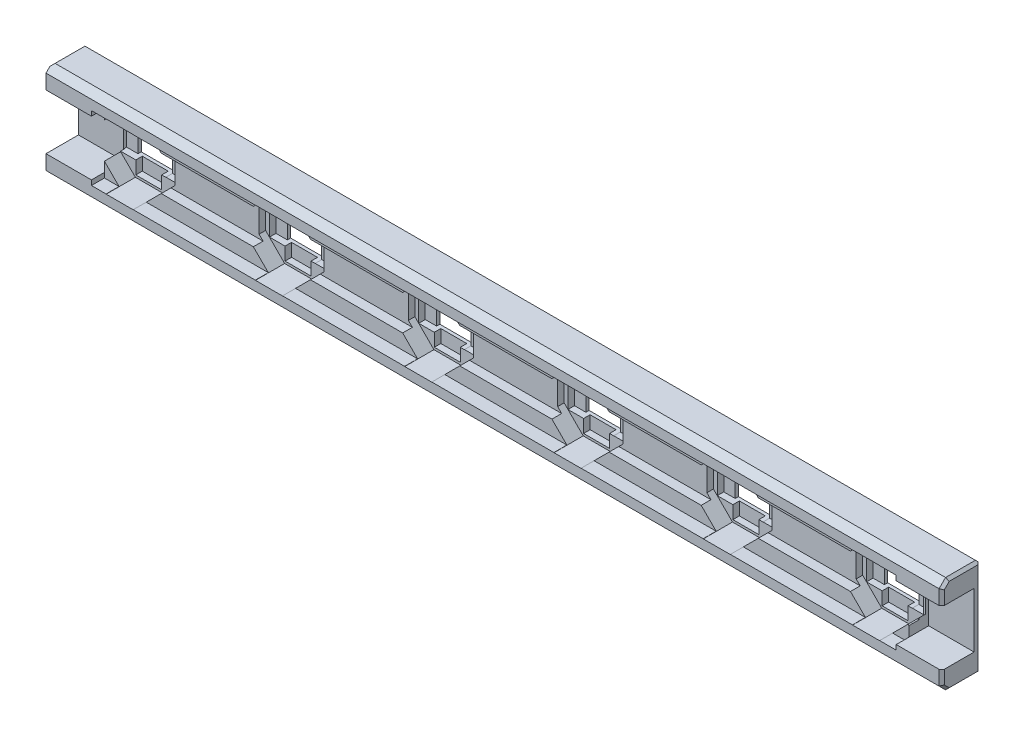
from build123d import *

# Parameters (mm, degrees)
SKETCH1_W                = 138
SKETCH1_H                = 15
BOSS_EXTRUDE1_DEPTH      = 6
CUT_EXTRUDE8_DEPTH       = 138
SKETCH13_W               = 0.5
SKETCH13_H               = 10
CUT_EXTRUDE9_DEPTH       = 0.6
FILLET1_R                = 0.25
FILLET2_R                = 0.25
CHAMFER1_SIZE            = 0.4
CHAMFER2_SIZE            = 0.4
CHAMFER3_SIZE            = 0.4
CHAMFER5_SIZE            = 0.4
CUT_EXTRUDE10_DEPTH      = 4.5
SKETCH16_W               = 5.3
SKETCH16_H               = 5.3
CUT_EXTRUDE11_DEPTH      = 4.5
SKETCH17_W               = 4
SKETCH17_H               = 2
CUT_EXTRUDE12_DEPTH      = 1
SKETCH18_W               = 1.75
SKETCH18_H               = 5.318073247
SKETCH18_H_2             = 5.281926753
CUT_EXTRUDE13_DEPTH      = 1
LPATTERN1_COUNT          = 6
LPATTERN1_PITCH          = 23
SKETCH19_W               = 7
SKETCH19_H               = 8.5
CUT_EXTRUDE14_DEPTH      = 5
SKETCH20_W               = 124
SKETCH20_H               = 10
CUT_EXTRUDE15_DEPTH      = 2
CUT_EXTRUDE16_DEPTH      = 80.806458515
CUT_EXTRUDE16_DEPTH_BACK = 80.806458515
SKETCH21_W               = 1.5
SKETCH21_H               = 5.392715996


with BuildPart() as part:
    # Sketch1 → Boss-Extrude1 (new body)
    with BuildSketch(Plane.XY):
        with Locations((-22.75, 18.154296875)):
            Rectangle(SKETCH1_W, SKETCH1_H)
    extrude(amount=BOSS_EXTRUDE1_DEPTH)

    # Sketch12 → Cut-Extrude8 (cut)
    with BuildSketch(Plane(origin=(46.25, 0, 0), x_dir=(0, 0, -1), z_dir=(1, 0, 0))):
        Polygon((-6, 25.654296875), (-6, 24.654296875), (-5, 25.654296875), align=None)
        Polygon((-6, 10.654296875), (-5, 10.654296875), (-6, 11.654296875), align=None)
    extrude(amount=-CUT_EXTRUDE8_DEPTH, mode=Mode.SUBTRACT)

    # Sketch13 → Cut-Extrude9 (cut)
    with BuildSketch(Plane(origin=(0, 0, 0), x_dir=(-1, 0, 0), z_dir=(0, 0, -1))):
        with Locations((89.5, 18.154296875)):
            Rectangle(SKETCH13_W, SKETCH13_H)
    extrude(amount=-CUT_EXTRUDE9_DEPTH, mode=Mode.SUBTRACT)

    # Fillet1
    fillet1_edges = [part.edges().sort_by_distance(p)[0] for p in [
        (-89.75, 18.154296875, 0),
    ]]
    fillet(fillet1_edges, radius=FILLET1_R)

    # Fillet2
    fillet2_edges = [part.edges().sort_by_distance(p)[0] for p in [
        (-89.25, 18.154296875, 0.6),
        (-89.5, 23.154296875, 0.6),
        (-89.75, 18.154296875, 0.6),
        (-89.5, 13.154296875, 0.6),
    ]]
    fillet(fillet2_edges, radius=FILLET2_R - 0.0001)  # a hair under: the kernel refuses the full size

    # Chamfer1
    chamfer1_edges = [part.edges().sort_by_distance(p)[0] for p in [
        (-22.75, 25.654296875, 0),
        (-22.75, 10.654296875, 0),
    ]]
    chamfer(chamfer1_edges, length=CHAMFER1_SIZE)

    # Chamfer2
    chamfer2_edges = [part.edges().sort_by_distance(p)[0] for p in [
        (46.25, 18.154296875, 0),
        (-91.75, 18.154296875, 0),
    ]]
    chamfer(chamfer2_edges, length=CHAMFER2_SIZE)

    # Chamfer3
    chamfer3_edges = [part.edges().sort_by_distance(p)[0] for p in [
        (-91.75, 25.654296875, 2.7),
        (-91.75, 10.654296875, 2.7),
    ]]
    chamfer(chamfer3_edges, length=CHAMFER3_SIZE)

    # Chamfer5
    chamfer5_edges = [part.edges().sort_by_distance(p)[0] for p in [
        (46.25, 18.154296875, 6),
        (46.25, 25.654296875, 2.7),
        (46.25, 10.654296875, 2.7),
        (46.25, 25.154296875, 5.5),
        (46.25, 11.154296875, 5.5),
    ]]
    chamfer(chamfer5_edges, length=CHAMFER5_SIZE)

    # Sketch15 → Cut-Extrude10 (cut)
    with BuildSketch(Plane.XY.offset(6)):
        Polygon((-75.382117138, 20.232772011), (-78.321524864, 23.172179737), (-82.478475136, 23.172179737), (-85.417882862, 20.232772011), (-85.417882862, 16.075821739), (-82.478475136, 13.136414013), (-78.321524864, 13.136414013), (-75.382117138, 16.075821739), align=None)
    cut_extrude10 = extrude(amount=-CUT_EXTRUDE10_DEPTH, mode=Mode.SUBTRACT)

    # Sketch16 → Cut-Extrude11 (cut)
    with BuildSketch(Plane.XY.offset(1.5)):
        with Locations((-80.417882862, 18.136414013)):
            Rectangle(SKETCH16_W, SKETCH16_H)
    cut_extrude11 = extrude(amount=-CUT_EXTRUDE11_DEPTH, mode=Mode.SUBTRACT)

    # Sketch17 → Cut-Extrude12 (cut)
    with BuildSketch(Plane.XY.offset(1.5)):
        with Locations((-80.417882862, 14.486414013)):
            Rectangle(SKETCH17_W, SKETCH17_H)
        with Locations((-80.417882862, 21.786414013)):
            Rectangle(SKETCH17_W, SKETCH17_H)
    cut_extrude12 = extrude(amount=-CUT_EXTRUDE12_DEPTH, mode=Mode.SUBTRACT)

    # Sketch18 → Cut-Extrude13 (cut)
    with BuildSketch(Plane.XY.offset(1.5)):
        with Locations((-83.942882862, 18.145450637)):
            Rectangle(SKETCH18_W, SKETCH18_H)
        with Locations((-76.892882862, 18.145450637)):
            Rectangle(SKETCH18_W, SKETCH18_H_2)
    cut_extrude13 = extrude(amount=-CUT_EXTRUDE13_DEPTH, mode=Mode.SUBTRACT)

    # LPattern1: Cut-Extrude10, Cut-Extrude11, Cut-Extrude12, Cut-Extrude13 ×6
    with Locations(*[(i * LPATTERN1_PITCH, 0, 0) for i in range(1, LPATTERN1_COUNT)]):
        add(cut_extrude10, mode=Mode.SUBTRACT)
        add(cut_extrude11, mode=Mode.SUBTRACT)
        add(cut_extrude12, mode=Mode.SUBTRACT)
        add(cut_extrude13, mode=Mode.SUBTRACT)

    # Sketch19 → Cut-Extrude14 (cut)
    with BuildSketch(Plane.XY.offset(6)):
        with Locations((-88.25, 18.154296875)):
            Rectangle(SKETCH19_W, SKETCH19_H)
        with Locations((42.75, 18.154296875)):
            Rectangle(SKETCH19_W, SKETCH19_H)
    extrude(amount=-CUT_EXTRUDE14_DEPTH, mode=Mode.SUBTRACT)

    # Sketch20 → Cut-Extrude15 (cut)
    with BuildSketch(Plane.XY.offset(6)):
        with Locations((-22.75, 18.154296875)):
            Rectangle(SKETCH20_W, SKETCH20_H)
    extrude(amount=-CUT_EXTRUDE15_DEPTH, mode=Mode.SUBTRACT)

    # Sketch21 → Cut-Extrude16 (cut, two sides: drawn at the far end of the back side and taken through both)
    with BuildSketch(Plane(origin=(-16.417882862, 0, 0), x_dir=(0, 0, -1), z_dir=(1, 0, 0)).offset(-CUT_EXTRUDE16_DEPTH_BACK)):
        with Locations((-3.25, 18.154296875)):
            Rectangle(SKETCH21_W, SKETCH21_H)
    extrude(amount=CUT_EXTRUDE16_DEPTH + CUT_EXTRUDE16_DEPTH_BACK, mode=Mode.SUBTRACT)


solid = part.part
